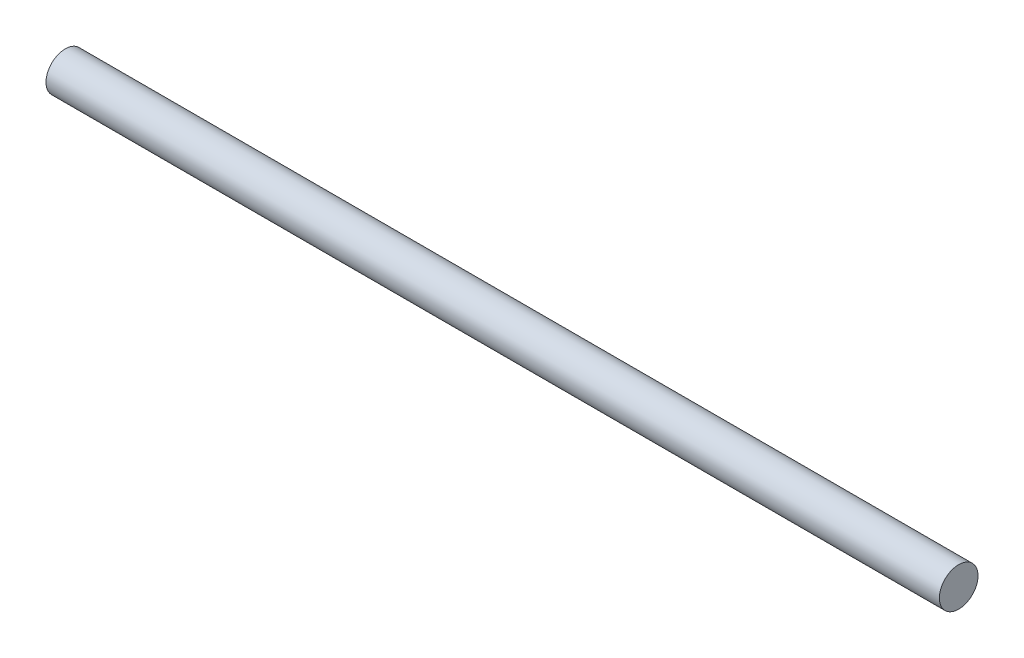
from build123d import *

# Parameters (mm, degrees)
BOSS_EXTRUDE2_OUTLINE_R = 3.175
BOSS_EXTRUDE2_DEPTH     = 146.812


# Read off the part's stored shape, not the designer's step: Boss-Extrude2
with BuildPart() as part:
    # Boss-Extrude2 outline → Boss-Extrude2 (new body)
    with BuildSketch(Plane(origin=(-98.013718438, 0, 0), x_dir=(0, 0, -1), z_dir=(1, 0, 0))):
        with Locations((-21.267819308, -167.583767489)):
            Circle(BOSS_EXTRUDE2_OUTLINE_R)
    extrude(amount=BOSS_EXTRUDE2_DEPTH)


solid = part.part
